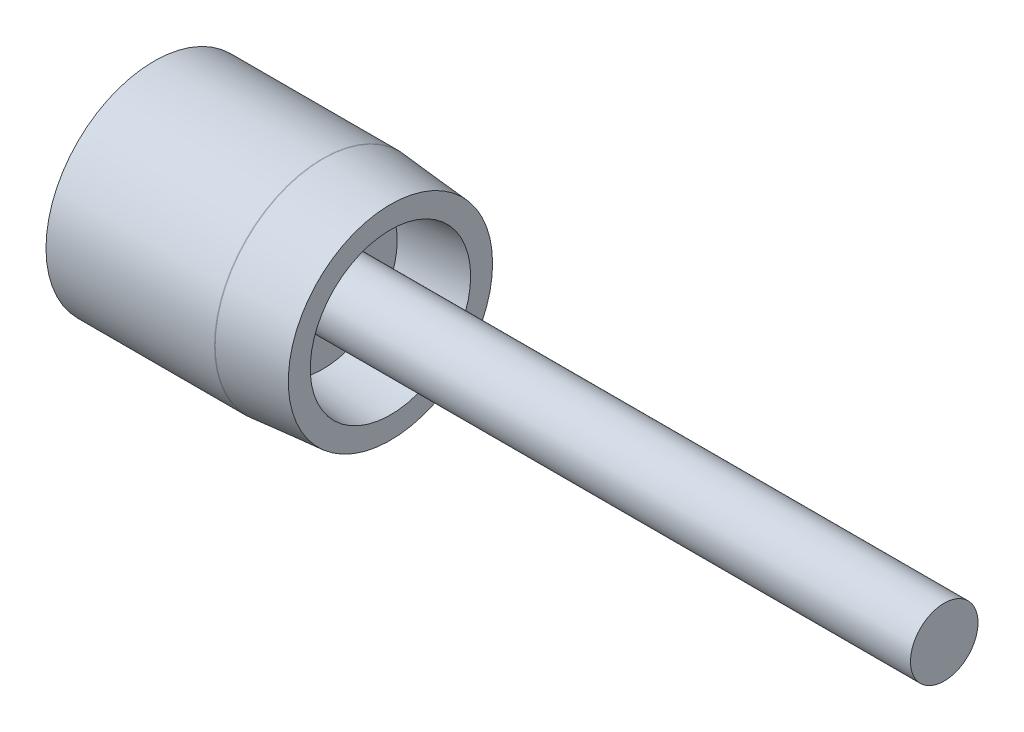
from build123d import *

# Parameters (mm, degrees)
SKETCH_2_R      = 5
EXTRUDE_1_DEPTH = 92
SKETCH_3_R      = 16
EXTRUDE_2_DEPTH = 25
SKETCH_4_R      = 16
SKETCH_4_R_2    = 11
EXTRUDE_3_DEPTH = 10
EXTRUDE_3_DRAFT = 5
FILLET_1_R      = 1


with BuildPart() as part:
    # 草图2 → 凸台-拉伸1 (new body)
    with BuildSketch(Plane(origin=(-136.095806698, 0, 0), x_dir=(0, 0, -1), z_dir=(1, 0, 0))):
        with Locations((-537.761833513, -181.314321461)):
            Circle(SKETCH_2_R)
    extrude(amount=-EXTRUDE_1_DEPTH)

    # 草图3 → 凸台-拉伸2 (add)
    with BuildSketch(Plane.ZY.offset(228.095806698)):
        with Locations((537.761833513, -181.314321461)):
            Circle(SKETCH_3_R)
    extrude(amount=EXTRUDE_2_DEPTH)


with BuildPart() as extrude_3_tool:
    # 草图4 → 凸台-拉伸3 (with draft: the straight prism first)
    with BuildSketch(Plane(origin=(-228.095806698, 0, 0), x_dir=(0, 0, -1), z_dir=(1, 0, 0))):
        with Locations((-537.761833513, -181.314321461)):
            Circle(SKETCH_4_R)
        with Locations((-537.761833513, -181.314321461)):
            Circle(SKETCH_4_R_2, mode=Mode.SUBTRACT)
    extrude(amount=EXTRUDE_3_DEPTH)
    # 凸台-拉伸3: the draft: its side faces are tilted about the plane it starts from
    extrude_3_sides = [extrude_3_tool.faces().sort_by_distance(p)[0] for p in [
        (-223.095806698, -181.314321461, 553.761833513),
        (-223.095806698, -181.314321461, 548.761833513),
    ]]
    draft(extrude_3_sides, Plane(origin=(-228.095806698, 0, 0), x_dir=(0, 0, -1), z_dir=(1, 0, 0)), EXTRUDE_3_DRAFT)


with BuildPart() as part_1:
    add(part.part)

    # 凸台-拉伸3: add extrude_3_tool
    add(extrude_3_tool.part)

    # 圆角1
    # the kernel refuses this fillet: 1 mm, written as the material it takes off along each edge
    with BuildSketch(Plane(origin=(-228.095806698, -181.314321461, 537.761833513), x_dir=(0, 0, 1), z_dir=(0, -1, 0))) as fillet_1_piece_1:
        with BuildLine():
            CenterArc((16 - FILLET_1_R, FILLET_1_R * 0.0436609429085), FILLET_1_R, 355, 5)
            Line((16 - FILLET_1_R * 0.0038053019083, -FILLET_1_R * 0.0434947998392), (16, 0))
            Line((16, 0), (16, FILLET_1_R * 0.0436609429085))
        make_face()
    revolve(axis=Axis((-228.095806698, -181.314321461, 537.761833513), (-1, 0, 0)), revolution_arc=180, mode=Mode.SUBTRACT)
    with BuildSketch(Plane(origin=(-228.095806698, -181.314321461, 537.761833513), x_dir=(0, 0, -1), z_dir=(0, 1, 0))) as fillet_1_piece_2:
        with BuildLine():
            CenterArc((16 - FILLET_1_R, FILLET_1_R * 0.0436609429085), FILLET_1_R, 355, 5)
            Line((16 - FILLET_1_R * 0.0038053019083, -FILLET_1_R * 0.0434947998392), (16, 0))
            Line((16, 0), (16, FILLET_1_R * 0.0436609429085))
        make_face()
    revolve(axis=Axis((-228.095806698, -181.314321461, 537.761833513), (-1, 0, 0)), revolution_arc=180, mode=Mode.SUBTRACT)


solid = part_1.part
